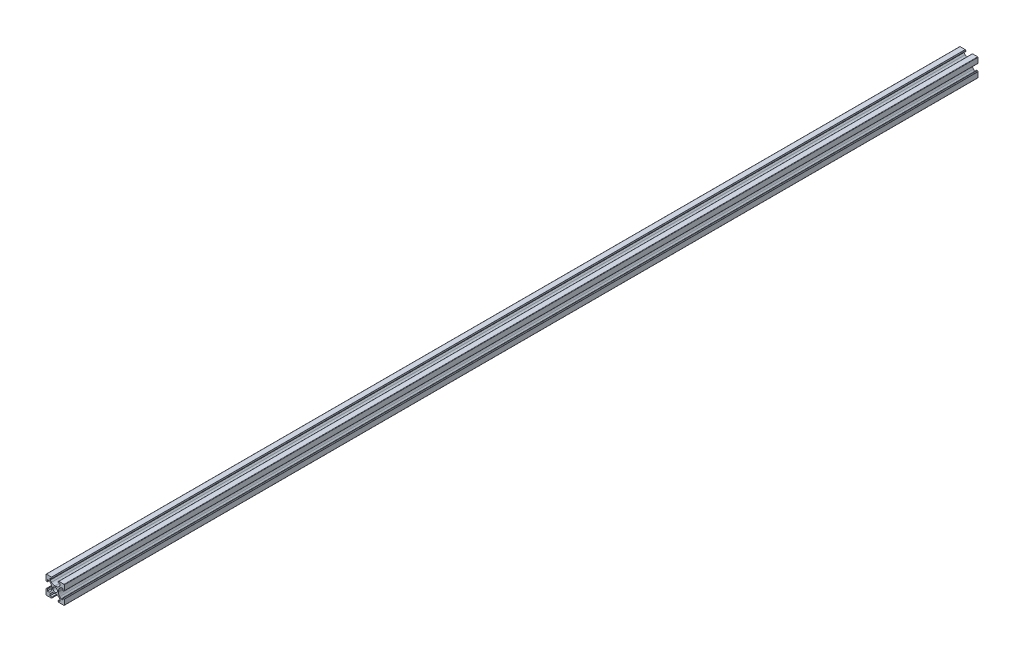
from build123d import *

# Parameters (mm, degrees)
RESSALTO_EXTRUS_O1_DEPTH = 1000
PADR_OCIRCULAR1_COUNT    = 4
FILETE1_R                = 0.4


with BuildPart() as part:
    # Esboço1 → Ressalto-extrusão1 (new body)
    with BuildSketch(Plane.XY):
        with BuildLine():
            ThreePointArc((-9.317157288, 3.217157288), (-9.187387948, 3.130448187), (-9.034314575, 3.1))
            Line((-9.034314575, 3.1), (-8.9, 3.1))
            ThreePointArc((-8.9, 3.1), (-8.617157288, 3.217157288), (-8.5, 3.5))
            Line((-8.5, 3.5), (-8.5, 5.5))
            Line((-8.5, 5.5), (-6.560660172, 5.5))
            Line((-6.560660172, 5.5), (-5.064466094, 4.003805922))
            ThreePointArc((-5.064466094, 4.003805922), (-3.980602337, 2.381689178), (-3.6, 0.468272016))
            Line((-3.6, 0.468272016), (-3.6, 0))
            Line((-3.6, 0), (-2.5, 0))
            ThreePointArc((-2.5, 0), (-1.767766953, 1.767766953), (0, 2.5))
            Line((0, 2.5), (0, 3.6))
            Line((0, 3.6), (-0.468272016, 3.6))
            ThreePointArc((-0.468272016, 3.6), (-2.381689178, 3.980602337), (-4.003805922, 5.064466094))
            Line((-4.003805922, 5.064466094), (-5.5, 6.560660172))
            Line((-5.5, 6.560660172), (-5.5, 8.5))
            Line((-5.5, 8.5), (-3.5, 8.5))
            ThreePointArc((-3.5, 8.5), (-3.217157288, 8.617157288), (-3.1, 8.9))
            Line((-3.1, 8.9), (-3.1, 9.034314575))
            ThreePointArc((-3.1, 9.034314575), (-3.130448187, 9.187387948), (-3.217157288, 9.317157288))
            Line((-3.217157288, 9.317157288), (-3.782842712, 9.882842712))
            ThreePointArc((-3.782842712, 9.882842712), (-3.912612052, 9.969551813), (-4.065685425, 10))
            Line((-4.065685425, 10), (-10, 10))
            Line((-10, 10), (-10, 4.065685425))
            ThreePointArc((-10, 4.065685425), (-9.969551813, 3.912612052), (-9.882842712, 3.782842712))
            Line((-9.882842712, 3.782842712), (-9.317157288, 3.217157288))
        make_face()
    ressalto_extrus_o1 = extrude(amount=RESSALTO_EXTRUS_O1_DEPTH)

    # PadrãoCircular1: Ressalto-extrusão1 ×4 about axis
    padr_ocircular1_axis = Axis((0, 0, 0), (0, 0, 1))
    for i in range(1, PADR_OCIRCULAR1_COUNT):
        add(ressalto_extrus_o1.rotate(padr_ocircular1_axis, i * 360 / PADR_OCIRCULAR1_COUNT))

    # Filete1
    filete1_edges = [part.edges().sort_by_distance(p)[0] for p in [
        (-10, -10, 500),
        (-10, 10, 500),
        (10, -10, 500),
        (10, 10, 500),
    ]]
    fillet(filete1_edges, radius=FILETE1_R)


solid = part.part
